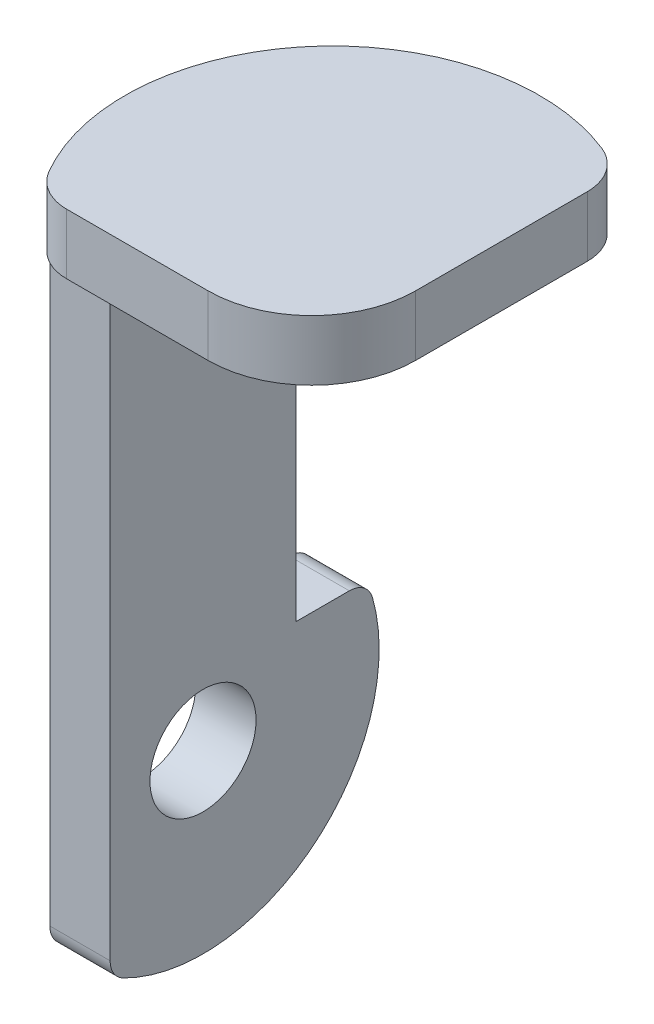
from build123d import *

# Parameters (mm, degrees)
BOSS_EXTRUDE2_DEPTH = 25
SKETCH2_R           = 22
BOSS_EXTRUDE5_DEPTH = 25


with BuildPart() as part:
    # Sketch1 → Boss-Extrude2 (new body)
    with BuildSketch(Plane(origin=(0, 0, 0), x_dir=(1, 0, 0), z_dir=(0, 1, 0))):
        with BuildLine():
            Line((44.366604969, 61.337334163), (44.366604969, -9.854360144))
            ThreePointArc((44.366604969, -9.854360144), (31.772196561, -40.259951735), (1.366604969, -52.854360144))
            Line((1.366604969, -52.854360144), (-57.241514826, -52.854360144))
            ThreePointArc((-57.241514826, -52.854360144), (-67.263557177, -50.162123347), (-74.587428409, -42.810226854))
            ThreePointArc((-74.587428409, -42.810226854), (-64.997689914, 56.314299301), (31.750424657, 79.924405122))
            ThreePointArc((31.750424657, 79.924405122), (40.914662163, 72.569511295), (44.366604969, 61.337334163))
        make_face()
    extrude(amount=-BOSS_EXTRUDE2_DEPTH)


with BuildPart() as body_2:
    # Sketch2 → Boss-Extrude5 (new body)
    with BuildSketch(Plane(origin=(-75, 0, 0), x_dir=(0, 0, -1), z_dir=(1, 0, 0))):
        with BuildLine():
            Line((-42.10091247, -215.369552032), (-42.10091247, -271.554514433))
            ThreePointArc((-42.10091247, -271.554514433), (-40.622593502, -276.787195618), (-36.624721994, -280.472762433))
            ThreePointArc((-36.624721994, -280.472762433), (42.737849826, -271.776281319), (66.674369895, -195.611397044))
            ThreePointArc((66.674369895, -195.611397044), (63.086411574, -190.347235632), (57.047618886, -188.317993618))
            Line((57.047618886, -188.317993618), (34.89908753, -188.317993618))
            Line((34.89908753, -188.317993618), (34.89908753, -25.369552032))
            Line((34.89908753, -25.369552032), (-42.10091247, -25.369552032))
            Line((-42.10091247, -25.369552032), (-42.10091247, -215.369552032))
        make_face()
        with Locations((-3.60091247, -215.369552032)):
            Circle(SKETCH2_R, mode=Mode.SUBTRACT)
    extrude(amount=BOSS_EXTRUDE5_DEPTH)


solid = Compound([part.part, body_2.part])
